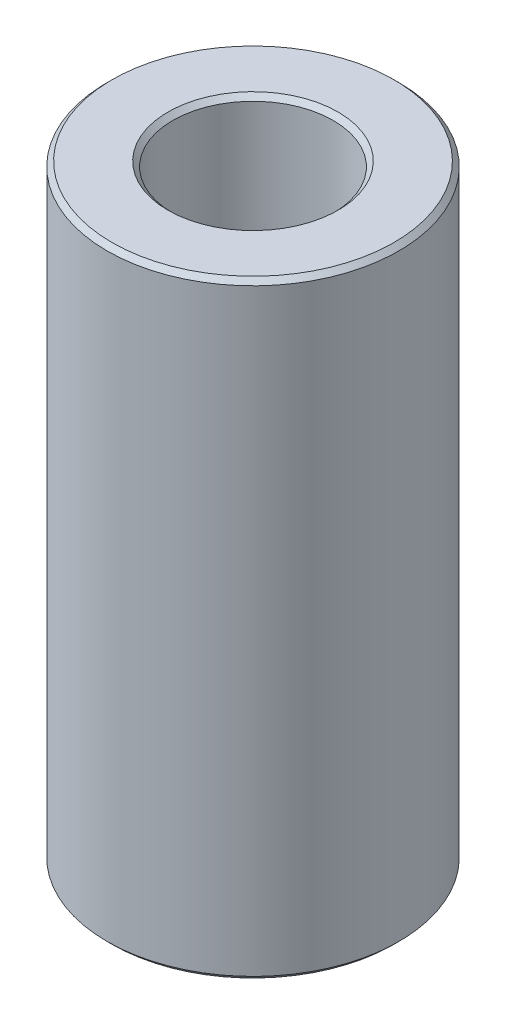
from build123d import *

# Parameters (mm, degrees)
SKETCH1_R            = 6
BOSS_EXTRUDE1_DEPTH  = 25
M6_CLEARANCE_HOLE1_D = 6.6
CHAMFER1_SIZE        = 0.2


with BuildPart() as part:
    # Sketch1 → Boss-Extrude1 (new body)
    with BuildSketch(Plane(origin=(0, 0, 0), x_dir=(1, 0, 0), z_dir=(0, 1, 0))):
        Circle(SKETCH1_R)
    extrude(amount=BOSS_EXTRUDE1_DEPTH)

    # M6 Clearance Hole1 (through all)
    with Locations(Plane(origin=(0, 25, 0), x_dir=(1, 0, 0), z_dir=(0, 1, 0))):
        with Locations((0, 0)):
            Hole(M6_CLEARANCE_HOLE1_D / 2)

    # Chamfer1
    chamfer1_edges = [part.edges().sort_by_distance(p)[0] for p in [
        (-6, 0, 0),
        (-6, 25, 0),
        (3.3, 0, 0),
        (3.3, 25, 0),
    ]]
    chamfer(chamfer1_edges, length=CHAMFER1_SIZE)


solid = part.part
